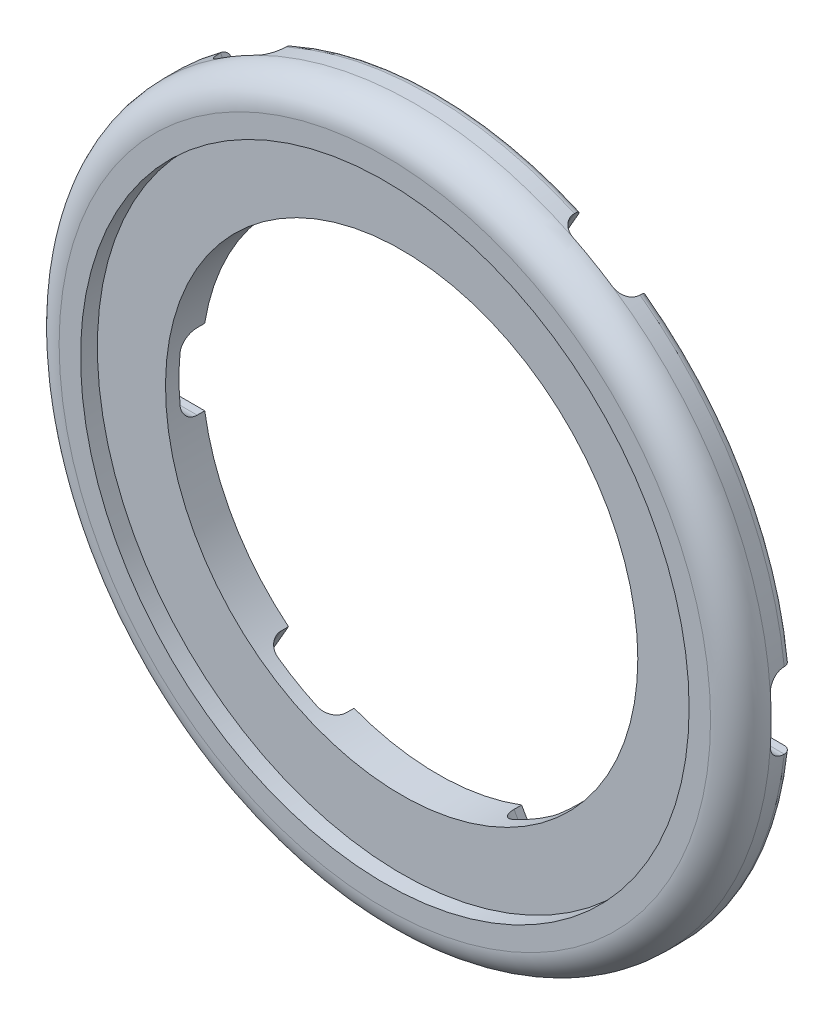
from build123d import *

# Parameters (mm, degrees)
SKETCH_1_R          = 23.515666667
SKETCH_1_R_2        = 15.6
EXTRUDE_1_DEPTH     = 3.5
SKETCH_2_R          = 1.15
CUT_EXTRUDE_1_DEPTH = 2.2
SKETCH_3_R          = 20.1
CUT_EXTRUDE_2_DEPTH = 1.11
FILLET_1_R          = 2
CUT_EXTRUDE_3_DEPTH = 1.5
FILLET_2_R          = 1
FILLET_3_R          = 0.5


with BuildPart() as part:
    # 草图1 → 凸台-拉伸1 (new body)
    with BuildSketch(Plane.XY):
        Circle(SKETCH_1_R)
        Circle(SKETCH_1_R_2, mode=Mode.SUBTRACT)
    extrude(amount=EXTRUDE_1_DEPTH)

    # 草图2 → 切除-拉伸1 (cut)
    with BuildSketch(Plane(origin=(0, 0, 0), x_dir=(-1, 0, 0), z_dir=(0, 0, -1))):
        with Locations((0.001412606, 17.617763249)):
            Circle(SKETCH_2_R)
        with Locations((15.258136834, 8.807658272)):
            Circle(SKETCH_2_R)
        with Locations((15.256724229, -8.810104977)):
            Circle(SKETCH_2_R)
        with Locations((-0.001412606, -17.617763249)):
            Circle(SKETCH_2_R)
        with Locations((-15.258136834, -8.807658272)):
            Circle(SKETCH_2_R)
        with Locations((-15.256724229, 8.810104977)):
            Circle(SKETCH_2_R)
    extrude(amount=-CUT_EXTRUDE_1_DEPTH, mode=Mode.SUBTRACT)

    # 草图3 → 切除-拉伸2 (cut)
    with BuildSketch(Plane.XY.offset(3.5)):
        Circle(SKETCH_3_R)
    extrude(amount=-CUT_EXTRUDE_2_DEPTH, mode=Mode.SUBTRACT)

    # 圆角1
    fillet_1_edges = [part.edges().sort_by_distance(p)[0] for p in [
        (-23.515666667, 0, 3.5),
    ]]
    fillet(fillet_1_edges, radius=FILLET_1_R)

    # 草图5 → 切除-拉伸3 (cut)
    with BuildSketch(Plane(origin=(0, 0, 0), x_dir=(-1, 0, 0), z_dir=(0, 0, -1))):
        with BuildLine():
            Line((-23.38239891, 2.5), (-15.398376538, 2.5))
            ThreePointArc((-15.398376538, 2.5), (-15.6, 0), (-15.398376538, -2.5))
            Line((-15.398376538, -2.5), (-23.38239891, -2.5))
            ThreePointArc((-23.38239891, -2.5), (-23.515666667, 0), (-23.38239891, 2.5))
        make_face()
        with BuildLine():
            Line((-9.526135945, 21.499751457), (-5.534124759, 14.585385259))
            ThreePointArc((-5.534124759, 14.585385259), (-7.8, 13.509996299), (-9.864251778, 12.085385259))
            Line((-9.864251778, 12.085385259), (-13.856262964, 18.999751457))
            ThreePointArc((-13.856262964, 18.999751457), (-11.757833333, 20.36516472), (-9.526135945, 21.499751457))
        make_face()
        with BuildLine():
            Line((13.856262964, 18.999751457), (9.864251778, 12.085385259))
            ThreePointArc((9.864251778, 12.085385259), (7.8, 13.509996299), (5.534124759, 14.585385259))
            Line((5.534124759, 14.585385259), (9.526135945, 21.499751457))
            ThreePointArc((9.526135945, 21.499751457), (11.757833333, 20.36516472), (13.856262964, 18.999751457))
        make_face()
        with BuildLine():
            Line((23.38239891, -2.5), (15.398376538, -2.5))
            ThreePointArc((15.398376538, -2.5), (15.6, 0), (15.398376538, 2.5))
            Line((15.398376538, 2.5), (23.38239891, 2.5))
            ThreePointArc((23.38239891, 2.5), (23.515666667, 0), (23.38239891, -2.5))
        make_face()
        with BuildLine():
            Line((9.526135945, -21.499751457), (5.534124759, -14.585385259))
            ThreePointArc((5.534124759, -14.585385259), (7.8, -13.509996299), (9.864251778, -12.085385259))
            Line((9.864251778, -12.085385259), (13.856262964, -18.999751457))
            ThreePointArc((13.856262964, -18.999751457), (11.757833333, -20.36516472), (9.526135945, -21.499751457))
        make_face()
        with BuildLine():
            Line((-13.856262964, -18.999751457), (-9.864251778, -12.085385259))
            ThreePointArc((-9.864251778, -12.085385259), (-7.8, -13.509996299), (-5.534124759, -14.585385259))
            Line((-5.534124759, -14.585385259), (-9.526135945, -21.499751457))
            ThreePointArc((-9.526135945, -21.499751457), (-11.757833333, -20.36516472), (-13.856262964, -18.999751457))
        make_face()
    extrude(amount=-CUT_EXTRUDE_3_DEPTH, mode=Mode.SUBTRACT)

    # 圆角2
    # the kernel refuses this fillet: 1 mm, written as the material it adds along each edge
    with BuildSketch(Plane(origin=(8.614251778, 9.920321749, 1.5), x_dir=(-0.8660254037844419, 0.49999999999999417, 0), z_dir=(0.4999999999999942, 0.866025403784442, 0))) as fillet_2_piece_1_section:
        with BuildLine():
            CenterArc((FILLET_2_R, -FILLET_2_R), FILLET_2_R, 90, 90)
            Line((0, -FILLET_2_R), (0, 0))
            Line((0, 0), (FILLET_2_R, 0))
        make_face()
    fillet_2_piece_1 = extrude(amount=12.984022372, mode=Mode.PRIVATE)
    fillet_2_piece_1 = fillet_2_piece_1 - Plane(origin=(0, 0, 0.938794672), x_dir=(1, 0, 0), z_dir=(0, 0, -1)) * Cylinder(15.6, 30, mode=Mode.PRIVATE)
    fillet_2_piece_1 = fillet_2_piece_1 & Plane(origin=(0, 0, 0.938794672), x_dir=(1, 0, 0), z_dir=(0, 0, -1)) * Cylinder(23.515666667, 30, mode=Mode.PRIVATE)
    add(fillet_2_piece_1)
    with BuildSketch(Plane(origin=(10.776135945, 23.664814967, 1.5), x_dir=(0.8660254037844438, -0.4999999999999911, 0), z_dir=(-0.49999999999999106, -0.8660254037844438, 0))) as fillet_2_piece_2_section:
        with BuildLine():
            CenterArc((FILLET_2_R, -FILLET_2_R), FILLET_2_R, 90, 90)
            Line((0, -FILLET_2_R), (0, 0))
            Line((0, 0), (FILLET_2_R, 0))
        make_face()
    fillet_2_piece_2 = extrude(amount=12.984022372, mode=Mode.PRIVATE)
    fillet_2_piece_2 = fillet_2_piece_2 & Plane(origin=(0, 0, 0.938797537), x_dir=(1, 0, 0), z_dir=(0, 0, -1)) * Cylinder(23.515666667, 30, mode=Mode.PRIVATE)
    fillet_2_piece_2 = fillet_2_piece_2 - Plane(origin=(0, 0, 0.938797537), x_dir=(1, 0, 0), z_dir=(0, 0, -1)) * Cylinder(15.6, 30, mode=Mode.PRIVATE)
    add(fillet_2_piece_2)
    with BuildSketch(Plane(origin=(12.898376538, -2.5, 1.5), x_dir=(0, 1, 0), z_dir=(1, 0, 0))) as fillet_2_piece_3_section:
        with BuildLine():
            CenterArc((FILLET_2_R, -FILLET_2_R), FILLET_2_R, 90, 90)
            Line((0, -FILLET_2_R), (0, 0))
            Line((0, 0), (FILLET_2_R, 0))
        make_face()
    fillet_2_piece_3 = extrude(amount=12.984022372, mode=Mode.PRIVATE)
    fillet_2_piece_3 = fillet_2_piece_3 - Plane(origin=(0, 0, 0.93879406), x_dir=(1, 0, 0), z_dir=(0, 0, -1)) * Cylinder(15.6, 30, mode=Mode.PRIVATE)
    fillet_2_piece_3 = fillet_2_piece_3 & Plane(origin=(0, 0, 0.93879406), x_dir=(1, 0, 0), z_dir=(0, 0, -1)) * Cylinder(23.515666667, 30, mode=Mode.PRIVATE)
    add(fillet_2_piece_3)
    with BuildSketch(Plane(origin=(25.88239891, 2.5, 1.5), x_dir=(0, -1, 0), z_dir=(-1, 0, 0))) as fillet_2_piece_4_section:
        with BuildLine():
            CenterArc((FILLET_2_R, -FILLET_2_R), FILLET_2_R, 90, 90)
            Line((0, -FILLET_2_R), (0, 0))
            Line((0, 0), (FILLET_2_R, 0))
        make_face()
    fillet_2_piece_4 = extrude(amount=12.984022372, mode=Mode.PRIVATE)
    fillet_2_piece_4 = fillet_2_piece_4 - Plane(origin=(0, 0, 0.938797991), x_dir=(1, 0, 0), z_dir=(0, 0, -1)) * Cylinder(15.6, 30, mode=Mode.PRIVATE)
    fillet_2_piece_4 = fillet_2_piece_4 & Plane(origin=(0, 0, 0.938797991), x_dir=(1, 0, 0), z_dir=(0, 0, -1)) * Cylinder(23.515666667, 30, mode=Mode.PRIVATE)
    add(fillet_2_piece_4)
    with BuildSketch(Plane(origin=(4.284124759, -12.420321749, 1.5), x_dir=(0.8660254037844404, 0.49999999999999695, 0), z_dir=(0.499999999999997, -0.8660254037844405, 0))) as fillet_2_piece_5_section:
        with BuildLine():
            CenterArc((FILLET_2_R, -FILLET_2_R), FILLET_2_R, 90, 90)
            Line((0, -FILLET_2_R), (0, 0))
            Line((0, 0), (FILLET_2_R, 0))
        make_face()
    fillet_2_piece_5 = extrude(amount=12.984022372, mode=Mode.PRIVATE)
    fillet_2_piece_5 = fillet_2_piece_5 - Plane(origin=(0, 0, 0.938794672), x_dir=(1, 0, 0), z_dir=(0, 0, -1)) * Cylinder(15.6, 30, mode=Mode.PRIVATE)
    fillet_2_piece_5 = fillet_2_piece_5 & Plane(origin=(0, 0, 0.938794672), x_dir=(1, 0, 0), z_dir=(0, 0, -1)) * Cylinder(23.515666667, 30, mode=Mode.PRIVATE)
    add(fillet_2_piece_5)
    with BuildSketch(Plane(origin=(15.106262964, -21.164814967, 1.5), x_dir=(-0.866025403784444, -0.49999999999999073, 0), z_dir=(-0.4999999999999907, 0.866025403784444, 0))) as fillet_2_piece_6_section:
        with BuildLine():
            CenterArc((FILLET_2_R, -FILLET_2_R), FILLET_2_R, 90, 90)
            Line((0, -FILLET_2_R), (0, 0))
            Line((0, 0), (FILLET_2_R, 0))
        make_face()
    fillet_2_piece_6 = extrude(amount=12.984022372, mode=Mode.PRIVATE)
    fillet_2_piece_6 = fillet_2_piece_6 & Plane(origin=(0, 0, 0.938797537), x_dir=(1, 0, 0), z_dir=(0, 0, -1)) * Cylinder(23.515666667, 30, mode=Mode.PRIVATE)
    fillet_2_piece_6 = fillet_2_piece_6 - Plane(origin=(0, 0, 0.938797537), x_dir=(1, 0, 0), z_dir=(0, 0, -1)) * Cylinder(15.6, 30, mode=Mode.PRIVATE)
    add(fillet_2_piece_6)
    with BuildSketch(Plane(origin=(-8.614251778, -9.920321749, 1.5), x_dir=(0.8660254037844386, -0.5000000000000001, 0), z_dir=(-0.5000000000000001, -0.8660254037844386, 0))) as fillet_2_piece_7_section:
        with BuildLine():
            CenterArc((FILLET_2_R, -FILLET_2_R), FILLET_2_R, 90, 90)
            Line((0, -FILLET_2_R), (0, 0))
            Line((0, 0), (FILLET_2_R, 0))
        make_face()
    fillet_2_piece_7 = extrude(amount=12.984022372, mode=Mode.PRIVATE)
    fillet_2_piece_7 = fillet_2_piece_7 - Plane(origin=(0, 0, 0.938796112), x_dir=(1, 0, 0), z_dir=(0, 0, -1)) * Cylinder(15.6, 30, mode=Mode.PRIVATE)
    fillet_2_piece_7 = fillet_2_piece_7 & Plane(origin=(0, 0, 0.938796112), x_dir=(1, 0, 0), z_dir=(0, 0, -1)) * Cylinder(23.515666667, 30, mode=Mode.PRIVATE)
    add(fillet_2_piece_7)
    with BuildSketch(Plane(origin=(-10.776135945, -23.664814967, 1.5), x_dir=(-0.8660254037844386, 0.5000000000000003, 0), z_dir=(0.5000000000000003, 0.8660254037844386, 0))) as fillet_2_piece_8_section:
        with BuildLine():
            CenterArc((FILLET_2_R, -FILLET_2_R), FILLET_2_R, 90, 90)
            Line((0, -FILLET_2_R), (0, 0))
            Line((0, 0), (FILLET_2_R, 0))
        make_face()
    fillet_2_piece_8 = extrude(amount=12.984022372, mode=Mode.PRIVATE)
    fillet_2_piece_8 = fillet_2_piece_8 & Plane(origin=(0, 0, 0.938799169), x_dir=(1, 0, 0), z_dir=(0, 0, -1)) * Cylinder(23.515666667, 30, mode=Mode.PRIVATE)
    fillet_2_piece_8 = fillet_2_piece_8 - Plane(origin=(0, 0, 0.938799169), x_dir=(1, 0, 0), z_dir=(0, 0, -1)) * Cylinder(15.6, 30, mode=Mode.PRIVATE)
    add(fillet_2_piece_8)
    with BuildSketch(Plane(origin=(-12.898376538, 2.5, 1.5), x_dir=(0, -1, 0), z_dir=(-1, 0, 0))) as fillet_2_piece_9_section:
        with BuildLine():
            CenterArc((FILLET_2_R, -FILLET_2_R), FILLET_2_R, 90, 90)
            Line((0, -FILLET_2_R), (0, 0))
            Line((0, 0), (FILLET_2_R, 0))
        make_face()
    fillet_2_piece_9 = extrude(amount=12.984022372, mode=Mode.PRIVATE)
    fillet_2_piece_9 = fillet_2_piece_9 - Plane(origin=(0, 0, 0.938794672), x_dir=(1, 0, 0), z_dir=(0, 0, -1)) * Cylinder(15.6, 30, mode=Mode.PRIVATE)
    fillet_2_piece_9 = fillet_2_piece_9 & Plane(origin=(0, 0, 0.938794672), x_dir=(1, 0, 0), z_dir=(0, 0, -1)) * Cylinder(23.515666667, 30, mode=Mode.PRIVATE)
    add(fillet_2_piece_9)
    with BuildSketch(Plane(origin=(-25.88239891, -2.5, 1.5), x_dir=(0, 1, 0), z_dir=(1, 0, 0))) as fillet_2_piece_10_section:
        with BuildLine():
            CenterArc((FILLET_2_R, -FILLET_2_R), FILLET_2_R, 90, 90)
            Line((0, -FILLET_2_R), (0, 0))
            Line((0, 0), (FILLET_2_R, 0))
        make_face()
    fillet_2_piece_10 = extrude(amount=12.984022372, mode=Mode.PRIVATE)
    fillet_2_piece_10 = fillet_2_piece_10 & Plane(origin=(0, 0, 0.938797537), x_dir=(1, 0, 0), z_dir=(0, 0, -1)) * Cylinder(23.515666667, 30, mode=Mode.PRIVATE)
    fillet_2_piece_10 = fillet_2_piece_10 - Plane(origin=(0, 0, 0.938797537), x_dir=(1, 0, 0), z_dir=(0, 0, -1)) * Cylinder(15.6, 30, mode=Mode.PRIVATE)
    add(fillet_2_piece_10)
    with BuildSketch(Plane(origin=(-4.284124759, 12.420321749, 1.5), x_dir=(-0.8660254037844386, -0.5000000000000001, 0), z_dir=(-0.5000000000000001, 0.8660254037844387, 0))) as fillet_2_piece_11_section:
        with BuildLine():
            CenterArc((FILLET_2_R, -FILLET_2_R), FILLET_2_R, 90, 90)
            Line((0, -FILLET_2_R), (0, 0))
            Line((0, 0), (FILLET_2_R, 0))
        make_face()
    fillet_2_piece_11 = extrude(amount=12.984022372, mode=Mode.PRIVATE)
    fillet_2_piece_11 = fillet_2_piece_11 - Plane(origin=(0, 0, 0.938796112), x_dir=(1, 0, 0), z_dir=(0, 0, -1)) * Cylinder(15.6, 30, mode=Mode.PRIVATE)
    fillet_2_piece_11 = fillet_2_piece_11 & Plane(origin=(0, 0, 0.938796112), x_dir=(1, 0, 0), z_dir=(0, 0, -1)) * Cylinder(23.515666667, 30, mode=Mode.PRIVATE)
    add(fillet_2_piece_11)
    with BuildSketch(Plane(origin=(-15.106262964, 21.164814967, 1.5), x_dir=(0.8660254037844387, 0.4999999999999998, 0), z_dir=(0.4999999999999999, -0.8660254037844388, 0))) as fillet_2_piece_12_section:
        with BuildLine():
            CenterArc((FILLET_2_R, -FILLET_2_R), FILLET_2_R, 90, 90)
            Line((0, -FILLET_2_R), (0, 0))
            Line((0, 0), (FILLET_2_R, 0))
        make_face()
    fillet_2_piece_12 = extrude(amount=12.984022372, mode=Mode.PRIVATE)
    fillet_2_piece_12 = fillet_2_piece_12 & Plane(origin=(0, 0, 0.938799169), x_dir=(1, 0, 0), z_dir=(0, 0, -1)) * Cylinder(23.515666667, 30, mode=Mode.PRIVATE)
    fillet_2_piece_12 = fillet_2_piece_12 - Plane(origin=(0, 0, 0.938799169), x_dir=(1, 0, 0), z_dir=(0, 0, -1)) * Cylinder(15.6, 30, mode=Mode.PRIVATE)
    add(fillet_2_piece_12)

    # 圆角3
    fillet_3_edges = [part.edges().sort_by_distance(p)[0] for p in [
        (-20.36516472, 11.757833333, 0),
        (-20.36516472, -11.757833333, 0),
        (0, -23.515666667, 0),
        (20.36516472, -11.757833333, 0),
        (0, 23.515666667, 0),
        (20.36516472, 11.757833333, 0),
    ]]
    fillet(fillet_3_edges, radius=FILLET_3_R)


solid = part.part
